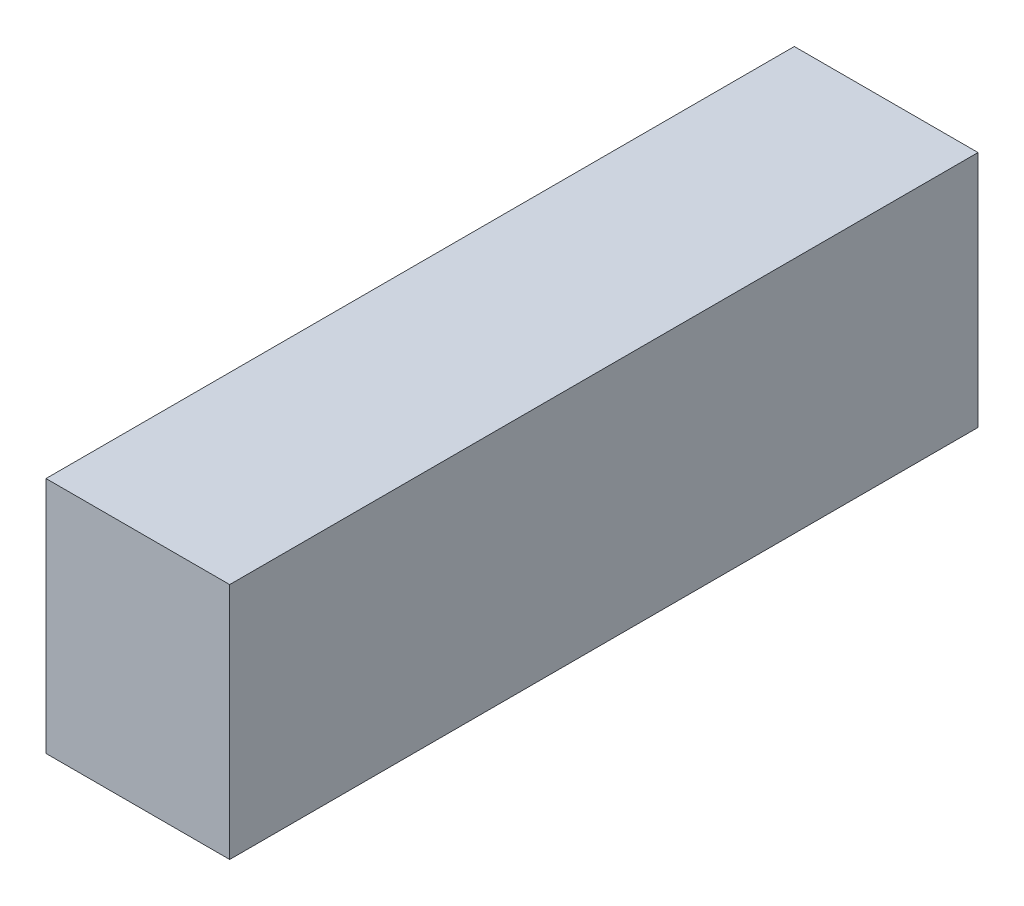
from build123d import *

# Parameters (mm, degrees)
SKETCH1_W           = 17.145
SKETCH1_H           = 69.85
BOSS_EXTRUDE1_DEPTH = 11.1125


with BuildPart() as part:
    # Sketch1 → Boss-Extrude1 (new, symmetric)
    with BuildSketch(Plane(origin=(0, 0, 0), x_dir=(1, 0, 0), z_dir=(0, 1, 0))):
        Rectangle(SKETCH1_W, SKETCH1_H)
    extrude(amount=BOSS_EXTRUDE1_DEPTH, both=True)


solid = part.part
